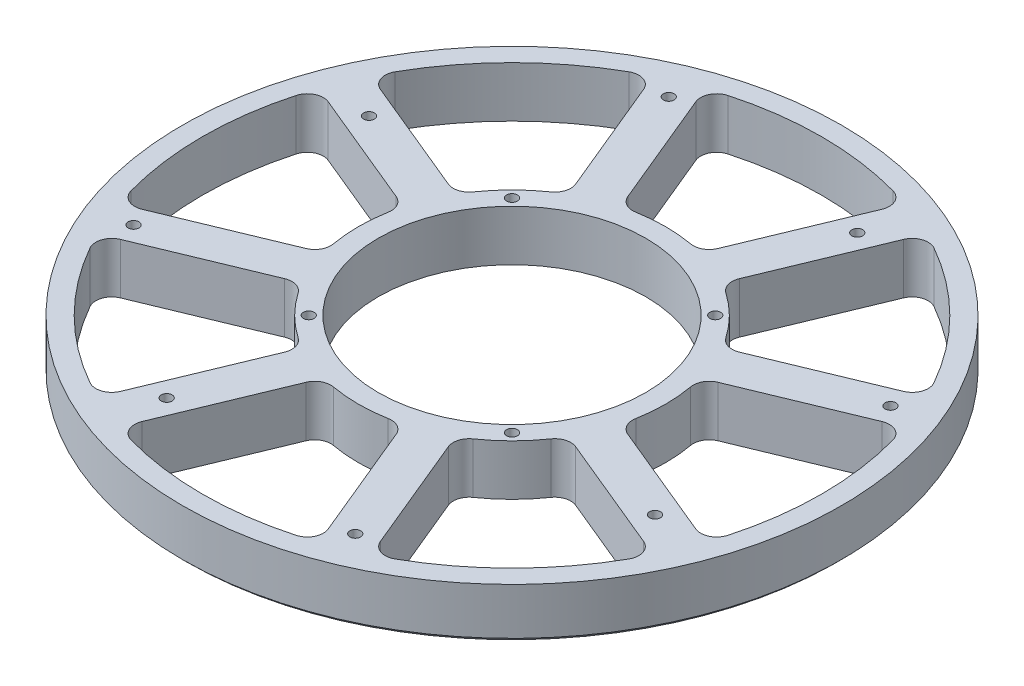
from build123d import *

# Parameters (mm, degrees)
SKETCH2_W                = 82.55
SKETCH2_H                = 12.7
F_6_32_TAPPED_HOLE1_D    = 2.7051
CIRPATTERN3_COUNT        = 4
CUT_EXTRUDE1_DEPTH       = 118.432086757
FILLET1_R                = 4
CIRPATTERN4_COUNT        = 8
FILLET1_OF_CIRPATTERN4_R = 4
CHAMFER2_SIZE            = 1
SKETCH9_R                = 33.5
CUT_EXTRUDE2_DEPTH       = 118.432086757


with BuildPart() as part:
    # Sketch2 → Revolve1 (revolve)
    with BuildSketch(Plane(origin=(0, 0, 0), x_dir=(0, 0, -1), z_dir=(1, 0, 0))):
        with Locations((-41.275, 6.35)):
            Rectangle(SKETCH2_W, SKETCH2_H)
    revolve(axis=Axis((0, -0.5, 0), (0, 1, 0)))

    # #6-32 Tapped Hole1 (through all)
    with Locations(Plane(origin=(0, 12.7, 0), x_dir=(1, 0, 0), z_dir=(0, 1, 0))):
        with Locations((-27.763683018, 67.027460084), (-61.160825052, 25.333643223), (-25.455844123, 25.455844123)):
            f_6_32_tapped_hole1 = Hole(F_6_32_TAPPED_HOLE1_D / 2)

    # CirPattern3: #6-32 Tapped Hole1 ×4 about axis
    cirpattern3_axis = Axis((0, -0.5, 0), (0, 1, 0))
    for i in range(1, CIRPATTERN3_COUNT):
        add(f_6_32_tapped_hole1.rotate(cirpattern3_axis, i * 360 / CIRPATTERN3_COUNT), mode=Mode.SUBTRACT)

    # Sketch8 → Cut-Extrude1 (cut, through all)
    with BuildSketch(Plane(origin=(0, 12.7, 0), x_dir=(1, 0, 0), z_dir=(0, 1, 0))):
        with BuildLine():
            Line((-9.989138252, 37.181542692), (-24.995954941, 73.411203073))
            ThreePointArc((-24.995954941, 73.411203073), (0, 77.55), (24.995954941, 73.411203073))
            Line((24.995954941, 73.411203073), (9.989138252, 37.181542692))
            ThreePointArc((9.989138252, 37.181542692), (0, 38.5), (-9.989138252, 37.181542692))
        make_face()
    cut_extrude1 = extrude(amount=-CUT_EXTRUDE1_DEPTH, mode=Mode.SUBTRACT)

    # Fillet1
    fillet1_edges = [part.edges().sort_by_distance(p)[0] for p in [
        (9.989138252, 6.35, -37.181542692),
        (24.995954941, 6.35, -73.411203073),
        (-9.989138252, 6.35, -37.181542692),
        (-24.995954941, 6.35, -73.411203073),
    ]]
    fillet(fillet1_edges, radius=FILLET1_R)

    # CirPattern4: Cut-Extrude1 ×8 about axis
    cirpattern4_axis = Axis((0, -0.5, 0), (0, 1, 0))
    for i in range(1, CIRPATTERN4_COUNT):
        add(cut_extrude1.rotate(cirpattern4_axis, i * 360 / CIRPATTERN4_COUNT), mode=Mode.SUBTRACT)

    # Fillet1 of CirPattern4
    fillet1_of_cirpattern4_edges = [part.edges().sort_by_distance(p)[0] for p in [
        (-19.227933577, 6.35, -33.354708369),
        (-34.234750266, 6.35, -69.584368749),
        (-33.354708369, 6.35, -19.227933577),
        (-69.584368749, 6.35, -34.234750266),
        (-37.181542692, 6.35, -9.989138252),
        (-73.411203073, 6.35, -24.995954941),
        (-37.181542692, 6.35, 9.989138252),
        (-73.411203073, 6.35, 24.995954941),
        (-33.354708369, 6.35, 19.227933577),
        (-69.584368749, 6.35, 34.234750266),
        (-19.227933577, 6.35, 33.354708369),
        (-34.234750266, 6.35, 69.584368749),
        (-9.989138252, 6.35, 37.181542692),
        (-24.995954941, 6.35, 73.411203073),
        (9.989138252, 6.35, 37.181542692),
        (24.995954941, 6.35, 73.411203073),
        (19.227933577, 6.35, 33.354708369),
        (34.234750266, 6.35, 69.584368749),
        (33.354708369, 6.35, 19.227933577),
        (69.584368749, 6.35, 34.234750266),
        (37.181542692, 6.35, 9.989138252),
        (73.411203073, 6.35, 24.995954941),
        (37.181542692, 6.35, -9.989138252),
        (73.411203073, 6.35, -24.995954941),
        (33.354708369, 6.35, -19.227933577),
        (69.584368749, 6.35, -34.234750266),
        (19.227933577, 6.35, -33.354708369),
        (34.234750266, 6.35, -69.584368749),
    ]]
    fillet(fillet1_of_cirpattern4_edges, radius=FILLET1_OF_CIRPATTERN4_R)

    # Chamfer2
    chamfer2_edges = [part.edges().sort_by_distance(p)[0] for p in [
        (0, 0, -82.55),
    ]]
    chamfer(chamfer2_edges, length=CHAMFER2_SIZE)

    # Sketch9 → Cut-Extrude2 (cut, through all)
    with BuildSketch(Plane(origin=(0, 12.7, 0), x_dir=(1, 0, 0), z_dir=(0, 1, 0))):
        Circle(SKETCH9_R)
    extrude(amount=-CUT_EXTRUDE2_DEPTH, mode=Mode.SUBTRACT)


solid = part.part
